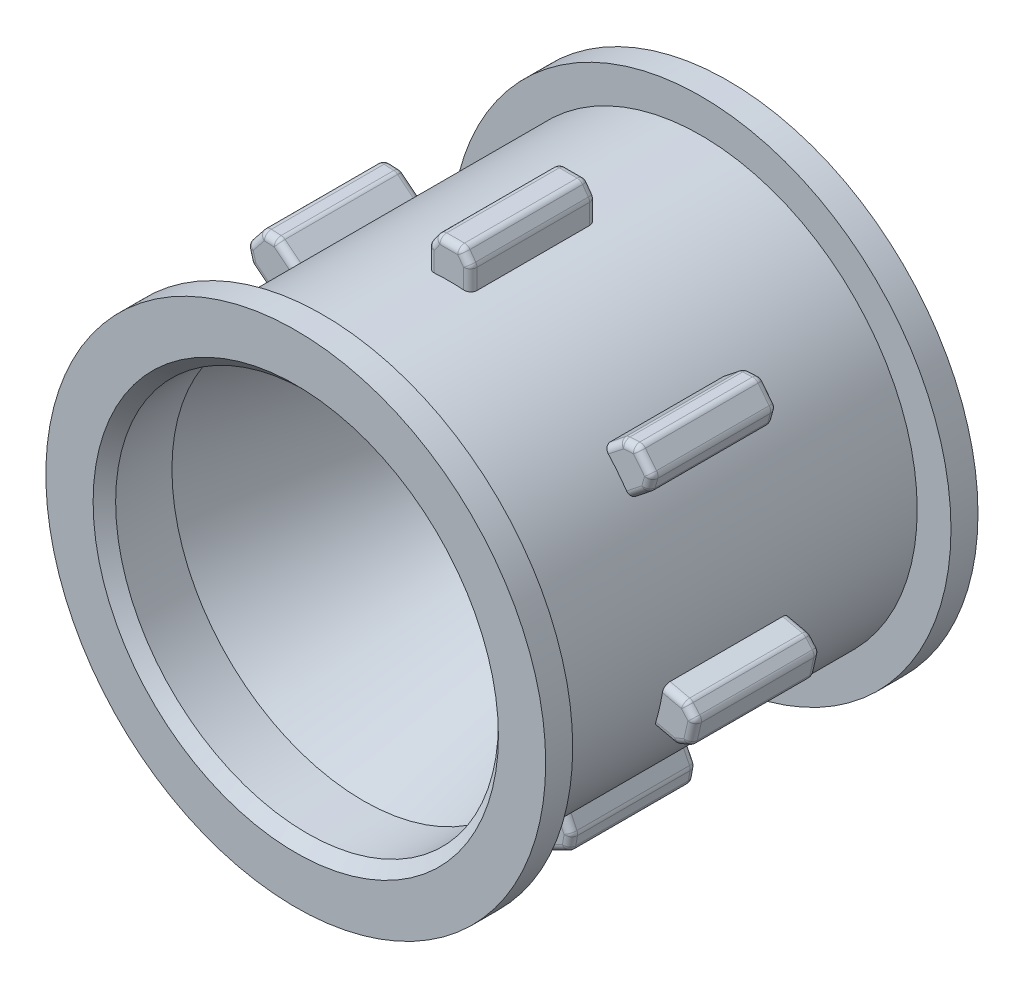
from build123d import *
from OCP.BRepFilletAPI import BRepFilletAPI_MakeChamfer

# Parameters (mm, degrees)
LAUFRAD_DEPTH                   = 8.4
LAUFRAD_DEPTH_BACK              = 8.4
SKIZZE1_R                       = 9.6
SKIZZE2_R                       = 11.1
KETTENF_HRUNG_DEPTH             = 1.2
SKIZZE4_R                       = 1.65
SCHRAUBENBOHRUNG_M3_DEPTH       = 25.800403223
SKIZZE3_R                       = 4.1
KUGELLAGERSITZ_DEPTH            = 4
FASE1_SIZE                      = 0.5
FASE1_SIZE2                     = 0.71146453
ZAHN_DEPTH                      = 2.8
VERRUNDUNG1_R                   = 0.3
KREISMUSTER1_COUNT              = 7
VERRUNDUNG1_OF_KREISMUSTER1_R   = 0.3
SKIZZE8_W                       = 4
SKIZZE8_H                       = 17
AUSCHNITT_ANTRIEB_WAGE_DEPTH    = 2
SKIZZE10_W                      = 17
SKIZZE10_H                      = 7
SCHNITT_LINEAR_AUSTRAGEN2_DEPTH = 2


with BuildPart() as part:
    # Skizze1 → Laufrad (new, two sides: drawn at the far end of the back side and taken through both)
    with BuildSketch(Plane.XY.offset(-LAUFRAD_DEPTH_BACK)):
        Circle(SKIZZE1_R)
    extrude(amount=LAUFRAD_DEPTH + LAUFRAD_DEPTH_BACK)

    # Skizze2 → Kettenführung (add)
    with BuildSketch(Plane.XY.offset(8.4)):
        Circle(SKIZZE2_R)
    kettenf_hrung = extrude(amount=KETTENF_HRUNG_DEPTH)

    # Spiegeln Kettenführung: Kettenführung across plane
    add(kettenf_hrung.mirror(Plane.XY))

    # Skizze4 → SchraubenBohrung M3 (cut, through all)
    with BuildSketch(Plane(origin=(0, 0, -9.6), x_dir=(-1, 0, 0), z_dir=(0, 0, -1))):
        Circle(SKIZZE4_R)
    extrude(amount=-SCHRAUBENBOHRUNG_M3_DEPTH, mode=Mode.SUBTRACT)

    # Skizze3 → Kugellagersitz (cut)
    with BuildSketch(Plane(origin=(0, 0, -9.6), x_dir=(-1, 0, 0), z_dir=(0, 0, -1))):
        Circle(SKIZZE3_R)
    extrude(amount=-KUGELLAGERSITZ_DEPTH, mode=Mode.SUBTRACT)

    # Skizze5 → Schnitt-Rotation3 (revolve, cut)
    with BuildSketch(Plane(origin=(0, 0, 0), x_dir=(0, 0, -1), z_dir=(1, 0, 0))):
        Polygon((-9.6, 0), (-9.6, 8.5), (-6.6, 8.5), (2.6, 6), (2.6, 0), align=None)
    revolve(axis=Axis((0, 0, -8.4), (0, 0, 1)), mode=Mode.SUBTRACT)

    # Fase1: one chamfer whose edges measure the first distance from different faces: ONE call of the kernel's chamfer builder (chamfer() names one face for all edges)
    fase1_edges_1 = [part.edges().sort_by_distance(p)[0] for p in [
        (1.65, 0, -2.6),
        (1.65, 0, -5.6),
        (4.1, 0, -9.6),
        (0, -8.5, 9.6),
    ]]
    fase1_edges_2 = [part.edges().sort_by_distance(p)[0] for p in [
        (0, -6, -2.6),
    ]]
    fase1_side_2 = [part.faces().sort_by_distance(p)[0] for p in [
        (0, -5.830294373, -2.6),
    ]]
    fase1 = BRepFilletAPI_MakeChamfer(part.part.solid().wrapped)
    for e in fase1_edges_1:
        fase1.Add(FASE1_SIZE, e.wrapped)
    for e in fase1_edges_2:
        fase1.Add(FASE1_SIZE, FASE1_SIZE2, e.wrapped, fase1_side_2[0].wrapped)  # the first distance lies on this face
    add(Compound.cast(fase1.Shape()), mode=Mode.REPLACE)

    # Skizze6 → Zahn (add, symmetric)
    with BuildSketch(Plane.XY):
        Polygon((0.55, 11.1), (-0.55, 11.1), (-0.95, 10.542409848), (-0.95, 9.552879147), (0.95, 9.552879147), (0.95, 10.542409848), align=None)
    zahn = extrude(amount=ZAHN_DEPTH, both=True)

    # Verrundung1
    verrundung1_edges = [part.edges().sort_by_distance(p)[0] for p in [
        (0.95, 10.542409848, 0),
        (-0.95, 10.542409848, 0),
        (-0.95, 10.047644498, -2.8),
        (-0.75, 10.821204924, -2.8),
        (0, 11.1, -2.8),
        (0.75, 10.821204924, -2.8),
        (0.95, 10.047644498, -2.8),
        (-0.55, 11.1, 0),
        (0.55, 11.1, 0),
        (-0.95, 10.047644498, 2.8),
        (-0.75, 10.821204924, 2.8),
        (0, 11.1, 2.8),
        (0.75, 10.821204924, 2.8),
        (0.95, 10.047644498, 2.8),
    ]]
    fillet(verrundung1_edges, radius=VERRUNDUNG1_R)

    # Kreismuster1: Zahn ×7 about axis
    kreismuster1_axis = Axis((0, 0, -8.4), (0, 0, 1))
    for i in range(1, KREISMUSTER1_COUNT):
        add(zahn.rotate(kreismuster1_axis, i * 360 / KREISMUSTER1_COUNT))

    # Verrundung1 of Kreismuster1
    verrundung1_of_kreismuster1_edges = [part.edges().sort_by_distance(p)[0] for p in [
        (-7.650072609, 7.315824936, 0),
        (-8.834703232, 5.830345119, 0),
        (-8.447880105, 5.521863969, -2.8),
        (-8.927976039, 6.160537302, -2.8),
        (-8.678329455, 6.920736801, -2.8),
        (-7.992741337, 7.333284526, -2.8),
        (-7.263249481, 7.007343785, -2.8),
        (-9.021248846, 6.490729485, 0),
        (-8.335410064, 7.350744116, 0),
        (-8.447880105, 5.521863969, 2.8),
        (-8.927976039, 6.160537302, 2.8),
        (-8.678329455, 6.920736801, 2.8),
        (-7.992741337, 7.333284526, 2.8),
        (-7.263249481, 7.007343785, 2.8),
        (-10.48948451, -1.419725369, 0),
        (-10.066694735, -3.272088402, 0),
        (-9.584334185, -3.161992754, -2.8),
        (-10.383004023, -3.13914056, -2.8),
        (-10.821699825, -2.469982367, -2.8),
        (-10.716785424, -1.676748692, -2.8),
        (-10.00712396, -1.309629721, -2.8),
        (-10.699313312, -3.006192719, 0),
        (-10.944086339, -1.933772015, 0),
        (-9.584334185, -3.161992754, 2.8),
        (-10.383004023, -3.13914056, 2.8),
        (-10.821699825, -2.469982367, 2.8),
        (-10.716785424, -1.676748692, 2.8),
        (-10.00712396, -1.309629721, 2.8),
        (-5.430100629, -9.086193514, 0),
        (-3.71825978, -9.910572618, 0),
        (-3.503589139, -9.46480444, -2.8),
        (-4.019418203, -10.074981554, -2.8),
        (-4.816109504, -10.000754434, -2.8),
        (-5.370871505, -9.424155945, -2.8),
        (-5.215429988, -8.640425336, -2.8),
        (-4.320576627, -10.23939049, 0),
        (-5.311642382, -9.762118377, 0),
        (-3.503589139, -9.46480444, 2.8),
        (-4.019418203, -10.074981554, 2.8),
        (-4.816109504, -10.000754434, 2.8),
        (-5.370871505, -9.424155945, 2.8),
        (-5.215429988, -8.640425336, 2.8),
        (3.71825978, -9.910572618, 0),
        (5.430100629, -9.086193514, 0),
        (5.215429988, -8.640425336, -2.8),
        (5.370871505, -9.424155945, -2.8),
        (4.816109504, -10.000754434, -2.8),
        (4.019418203, -10.074981554, -2.8),
        (3.503589139, -9.46480444, -2.8),
        (5.311642382, -9.762118377, 0),
        (4.320576627, -10.23939049, 0),
        (5.215429988, -8.640425336, 2.8),
        (5.370871505, -9.424155945, 2.8),
        (4.816109504, -10.000754434, 2.8),
        (4.019418203, -10.074981554, 2.8),
        (3.503589139, -9.46480444, 2.8),
        (10.066694735, -3.272088402, 0),
        (10.48948451, -1.419725369, 0),
        (10.00712396, -1.309629721, -2.8),
        (10.716785424, -1.676748692, -2.8),
        (10.821699825, -2.469982367, -2.8),
        (10.383004023, -3.13914056, -2.8),
        (9.584334185, -3.161992754, -2.8),
        (10.944086339, -1.933772015, 0),
        (10.699313312, -3.006192719, 0),
        (10.00712396, -1.309629721, 2.8),
        (10.716785424, -1.676748692, 2.8),
        (10.821699825, -2.469982367, 2.8),
        (10.383004023, -3.13914056, 2.8),
        (9.584334185, -3.161992754, 2.8),
        (8.834703232, 5.830345119, 0),
        (7.650072609, 7.315824936, 0),
        (7.263249481, 7.007343785, -2.8),
        (7.992741337, 7.333284526, -2.8),
        (8.678329455, 6.920736801, -2.8),
        (8.927976039, 6.160537302, -2.8),
        (8.447880105, 5.521863969, -2.8),
        (8.335410064, 7.350744116, 0),
        (9.021248846, 6.490729485, 0),
        (7.263249481, 7.007343785, 2.8),
        (7.992741337, 7.333284526, 2.8),
        (8.678329455, 6.920736801, 2.8),
        (8.927976039, 6.160537302, 2.8),
        (8.447880105, 5.521863969, 2.8),
    ]]
    fillet(verrundung1_of_kreismuster1_edges, radius=VERRUNDUNG1_OF_KREISMUSTER1_R)

    # Skizze8 → Auschnitt Antrieb Wage (cut)
    with BuildSketch(Plane(origin=(0, 0, -9.6), x_dir=(-1, 0, 0), z_dir=(0, 0, -1))):
        Rectangle(SKIZZE8_W, SKIZZE8_H)
    extrude(amount=-AUSCHNITT_ANTRIEB_WAGE_DEPTH, mode=Mode.SUBTRACT)

    # Skizze10 → Schnitt-Linear austragen2 (cut)
    with BuildSketch(Plane(origin=(0, 0, -9.6), x_dir=(-1, 0, 0), z_dir=(0, 0, -1))):
        Rectangle(SKIZZE10_W, SKIZZE10_H)
    extrude(amount=-SCHNITT_LINEAR_AUSTRAGEN2_DEPTH, mode=Mode.SUBTRACT)


solid = part.part
